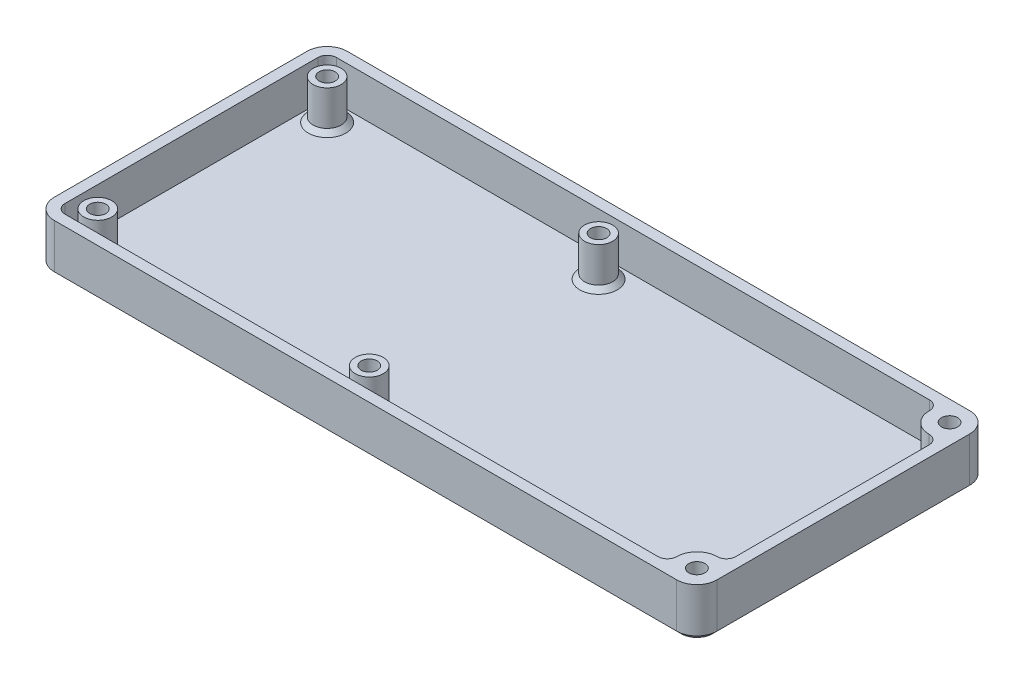
from build123d import *

# Parameters (mm, degrees)
SKETCH3_W                                         = 141.6
SKETCH3_H                                         = 62.6
SKETCH3_W_2                                       = 137
SKETCH3_H_2                                       = 58
BOSS_EXTRUDE1_DEPTH                               = 10.5
SKETCH5_W                                         = 137
SKETCH5_H                                         = 58
BOSS_EXTRUDE2_DEPTH                               = 2
SKETCH6_R                                         = 3
BOSS_EXTRUDE3_DEPTH                               = 8.5
FILLET6_R                                         = 2
FILLET8_R                                         = 2
CHAMFER1_SIZE                                     = 1
SKETCH24_R                                        = 4.3
BOSS_EXTRUDE7_DEPTH                               = 8.5
FILLET21_R                                        = 2
FILLET22_R                                        = 2
FILLET20_R                                        = 4.3
CSK_FOR_4_FLAT_HEAD_SOCKET_CAP_SCREW1_D           = 3.4544
CSK_FOR_4_FLAT_HEAD_SOCKET_CAP_SCREW1_DEPTH       = 14
CSK_FOR_4_FLAT_HEAD_SOCKET_CAP_SCREW1_CSINK_D     = 6.723761
CSK_FOR_4_FLAT_HEAD_SOCKET_CAP_SCREW1_CSINK_ANGLE = 82
CSK_FOR_4_FLAT_HEAD_SOCKET_CAP_SCREW1_TIP         = 1.037806461
CHAMFER7_SIZE                                     = 1


# Some blends are built 0.0001 mm under size
with BuildPart() as part:
    # Sketch3 → Boss-Extrude1 (new body)
    with BuildSketch(Plane(origin=(0, 0, 0), x_dir=(1, 0, 0), z_dir=(0, 1, 0))):
        with Locations((-4.061766162, 3.105993834)):
            Rectangle(SKETCH3_W, SKETCH3_H)
        with Locations((-4.061766162, 3.105993834)):
            Rectangle(SKETCH3_W_2, SKETCH3_H_2, mode=Mode.SUBTRACT)
    extrude(amount=BOSS_EXTRUDE1_DEPTH)

    # Sketch5 → Boss-Extrude2 (add)
    with BuildSketch(Plane(origin=(0, 0, 0), x_dir=(1, 0, 0), z_dir=(0, 1, 0))):
        with Locations((-4.061766162, 3.105993834)):
            Rectangle(SKETCH5_W, SKETCH5_H)
    extrude(amount=BOSS_EXTRUDE2_DEPTH)

    # Sketch6 → Boss-Extrude3 (add)
    with BuildSketch(Plane(origin=(0, 2, 0), x_dir=(1, 0, 0), z_dir=(0, 1, 0))):
        with Locations(Location((-68.061766162, 27.605993834, 0), (0, 0, 270))):
            Circle(SKETCH6_R)
        with Locations(Location((-68.061766162, -21.394006166, 0), (0, 0, 270))):
            Circle(SKETCH6_R)
        with Locations(Location((-10.061766162, -21.394006166, 0), (0, 0, 270))):
            Circle(SKETCH6_R)
        with Locations(Location((-10.061766162, 27.605993834, 0), (0, 0, 270))):
            Circle(SKETCH6_R)
    extrude(amount=BOSS_EXTRUDE3_DEPTH)

    # Fillet6
    fillet6_edges = [part.edges().sort_by_distance(p)[0] for p in [
        (64.438233838, 6.25, -32.105993834),
    ]]
    fillet(fillet6_edges, radius=FILLET6_R)

    # Fillet8
    fillet8_edges = [part.edges().sort_by_distance(p)[0] for p in [
        (-72.561766162, 6.25, -32.105993834),
        (-72.561766162, 6.25, 25.894006166),
    ]]
    fillet(fillet8_edges, radius=FILLET8_R)

    # Chamfer1
    chamfer1_edges = [part.edges().sort_by_distance(p)[0] for p in [
        (-68.061766162, 2, -30.605993834),
        (-68.061766162, 2, 18.394006166),
        (-10.061766162, 2, 18.394006166),
        (-10.061766162, 2, -30.605993834),
    ]]
    chamfer(chamfer1_edges, length=CHAMFER1_SIZE)

    # Sketch24 → Boss-Extrude7 (add)
    with BuildSketch(Plane(origin=(0, 2, 0), x_dir=(1, 0, 0), z_dir=(0, 1, 0))):
        with Locations((62.438233838, -23.894006166)):
            Circle(SKETCH24_R)
        with Locations((62.438233838, 30.01834388)):
            Circle(SKETCH24_R)
    extrude(amount=BOSS_EXTRUDE7_DEPTH)

    # Fillet21
    fillet21_edges = [part.edges().sort_by_distance(p)[0] for p in [
        (58.631660576, 6.25, 25.894006166),
    ]]
    fillet(fillet21_edges, radius=FILLET21_R)

    # Fillet22
    fillet22_edges = [part.edges().sort_by_distance(p)[0] for p in [
        (64.438233838, 6.25, -26.211770618),
        (58.679016144, 6.25, -32.105993834),
        (64.438233838, 6.25, 20.087432904),
    ]]
    fillet(fillet22_edges, radius=FILLET22_R)

    # Fillet20
    fillet20_edges = [part.edges().sort_by_distance(p)[0] for p in [
        (-74.861766162, 5.25, -34.405993834),
        (66.738233838, 5.25, -34.405993834),
        (66.738233838, 5.25, 28.194006166),
        (-74.861766162, 5.25, 28.194006166),
    ]]
    fillet(fillet20_edges, radius=FILLET20_R - 0.0001)  # a hair under: the kernel refuses the full size

    # CSK for #4 Flat Head Socket Cap Screw1
    with Locations(Plane(origin=(0, 0, 0), x_dir=(-1, 0, 0), z_dir=(0, -1, 0))):
        with Locations((68.061766162, 27.605993834), (68.061766162, -21.394006166), (-62.438233838, 30.105993834), (-62.438233838, -23.894006166), (10.061766162, -21.394006166), (10.061766162, 27.605993834)):
            CounterSinkHole(CSK_FOR_4_FLAT_HEAD_SOCKET_CAP_SCREW1_D / 2, CSK_FOR_4_FLAT_HEAD_SOCKET_CAP_SCREW1_CSINK_D / 2, depth=CSK_FOR_4_FLAT_HEAD_SOCKET_CAP_SCREW1_DEPTH, counter_sink_angle=CSK_FOR_4_FLAT_HEAD_SOCKET_CAP_SCREW1_CSINK_ANGLE)
            with Locations((0, 0, -(CSK_FOR_4_FLAT_HEAD_SOCKET_CAP_SCREW1_DEPTH + CSK_FOR_4_FLAT_HEAD_SOCKET_CAP_SCREW1_TIP / 2))):  # 118° drill point
                Cone(0, CSK_FOR_4_FLAT_HEAD_SOCKET_CAP_SCREW1_D / 2, CSK_FOR_4_FLAT_HEAD_SOCKET_CAP_SCREW1_TIP, mode=Mode.SUBTRACT)

    # Chamfer7
    # the kernel refuses this chamfer: 1 mm, written as the material it takes off along each edge
    with BuildSketch(Plane(origin=(62.438333838, 0, -34.405993834), x_dir=(0, -0.027495876610586292, 0.9996219169112968), z_dir=(-1, 0, 0)), Plane(origin=(-70.561866162, 0, 28.194006166), x_dir=(0, -0.02749587661058639, -0.9996219169112968), z_dir=(1, 0, 0))) as chamfer7_piece_1:
        Polygon((CHAMFER7_SIZE * 0.999621916911, CHAMFER7_SIZE * 0.0274958766106), (-CHAMFER7_SIZE * 0.0274958766106, CHAMFER7_SIZE * 0.999621916911), (0, 0), align=None)
    extrude(amount=133.0002, mode=Mode.SUBTRACT)
    with BuildSketch(Plane(origin=(-74.861766162, 0, -30.106093834), x_dir=(0.9996219169112968, -0.027495876610586483, 0), z_dir=(0, 0, 1)), Plane(origin=(66.738233838, 0, 23.894106166), x_dir=(-0.9996219169112968, -0.027495876610586483, 0), z_dir=(0, 0, -1))) as chamfer7_piece_2:
        Polygon((CHAMFER7_SIZE * 0.999621916911, CHAMFER7_SIZE * 0.0274958766106), (-CHAMFER7_SIZE * 0.0274958766106, CHAMFER7_SIZE * 0.999621916911), (0, 0), align=None)
    extrude(amount=54.0002, mode=Mode.SUBTRACT)
    with BuildSketch(Plane(origin=(62.438333838, 0, 23.894106166), x_dir=(0, 0, 1), z_dir=(-1, 0, 0))) as chamfer7_piece_3:
        Polygon((4.2999 - CHAMFER7_SIZE, 0), (4.2999, CHAMFER7_SIZE), (4.2999, 0), align=None)
    revolve(axis=Axis((62.438333838, 0, 23.894106166), (0, 1, 0)), revolution_arc=90, mode=Mode.SUBTRACT)
    with BuildSketch(Plane(origin=(-70.561866162, 0, 23.894106166), x_dir=(0, 0, 1), z_dir=(1, 0, 0))) as chamfer7_piece_4:
        Polygon((4.2999 - CHAMFER7_SIZE, 0), (4.2999, -CHAMFER7_SIZE), (4.2999, 0), align=None)
    revolve(axis=Axis((-70.561866162, 0, 23.894106166), (0, -1, 0)), revolution_arc=90, mode=Mode.SUBTRACT)
    with BuildSketch(Plane(origin=(-70.561866162, 0, -30.106093834), x_dir=(0, 0, -1), z_dir=(1, 0, 0))) as chamfer7_piece_5:
        Polygon((4.2999 - CHAMFER7_SIZE, 0), (4.2999, CHAMFER7_SIZE), (4.2999, 0), align=None)
    revolve(axis=Axis((-70.561866162, 0, -30.106093834), (0, 1, 0)), revolution_arc=90, mode=Mode.SUBTRACT)
    with BuildSketch(Plane(origin=(62.438333838, 0, -30.106093834), x_dir=(1, 0, 0), z_dir=(0, 0, 1))) as chamfer7_piece_6:
        Polygon((4.2999 - CHAMFER7_SIZE, 0), (4.2999, CHAMFER7_SIZE), (4.2999, 0), align=None)
    revolve(axis=Axis((62.438333838, 0, -30.106093834), (0, 1, 0)), revolution_arc=90, mode=Mode.SUBTRACT)


solid = part.part
